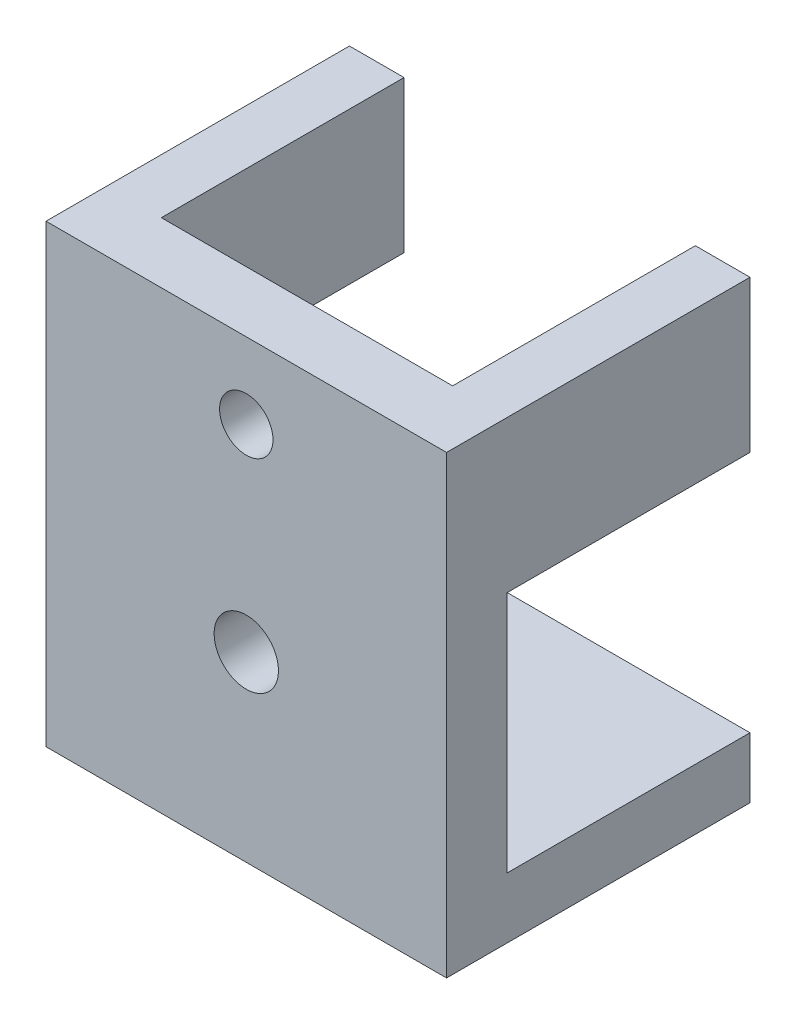
from build123d import *

# Parameters (mm, degrees)
SKETCH2_W           = 33
SKETCH2_H           = 37.5
BOSS_EXTRUDE1_DEPTH = 5
SKETCH3_W           = 33
SKETCH3_H           = 5
BOSS_EXTRUDE2_DEPTH = 20
SKETCH6_R           = 2.65
CUT_EXTRUDE2_DEPTH  = 10
SKETCH7_R           = 2.65
CUT_EXTRUDE3_DEPTH  = 10
SKETCH8_W           = 4.5
SKETCH8_H           = 12.5
BOSS_EXTRUDE3_DEPTH = 20
SKETCH9_R           = 2.2
CUT_EXTRUDE4_DEPTH  = 10


with BuildPart() as part:
    # Sketch2 → Boss-Extrude1 (new body)
    with BuildSketch(Plane.XY):
        with Locations((16.5, 18.75)):
            Rectangle(SKETCH2_W, SKETCH2_H)
    extrude(amount=BOSS_EXTRUDE1_DEPTH)

    # Sketch3 → Boss-Extrude2 (add)
    with BuildSketch(Plane.XY):
        with Locations((16.5, 2.5)):
            Rectangle(SKETCH3_W, SKETCH3_H)
    extrude(amount=-BOSS_EXTRUDE2_DEPTH)

    # Sketch6 → Cut-Extrude2 (cut)
    with BuildSketch(Plane.XZ):
        with Locations((16.5, -10)):
            Circle(SKETCH6_R)
    extrude(amount=-CUT_EXTRUDE2_DEPTH, mode=Mode.SUBTRACT)

    # Sketch7 → Cut-Extrude3 (cut)
    with BuildSketch(Plane(origin=(0, 0, 0), x_dir=(-1, 0, 0), z_dir=(0, 0, -1))):
        with Locations((-16.5, 15)):
            Circle(SKETCH7_R)
    extrude(amount=-CUT_EXTRUDE3_DEPTH, mode=Mode.SUBTRACT)

    # Sketch8 → Boss-Extrude3 (add)
    with BuildSketch(Plane(origin=(0, 0, 0), x_dir=(-1, 0, 0), z_dir=(0, 0, -1))):
        with Locations((-30.75, 31.25)):
            Rectangle(SKETCH8_W, SKETCH8_H)
        with Locations((-2.25, 31.25)):
            Rectangle(SKETCH8_W, SKETCH8_H)
    extrude(amount=BOSS_EXTRUDE3_DEPTH)

    # Sketch9 → Cut-Extrude4 (cut)
    with BuildSketch(Plane.XY.offset(5)):
        with Locations((16.5, 31.25)):
            Circle(SKETCH9_R)
    extrude(amount=-CUT_EXTRUDE4_DEPTH, mode=Mode.SUBTRACT)


solid = part.part
